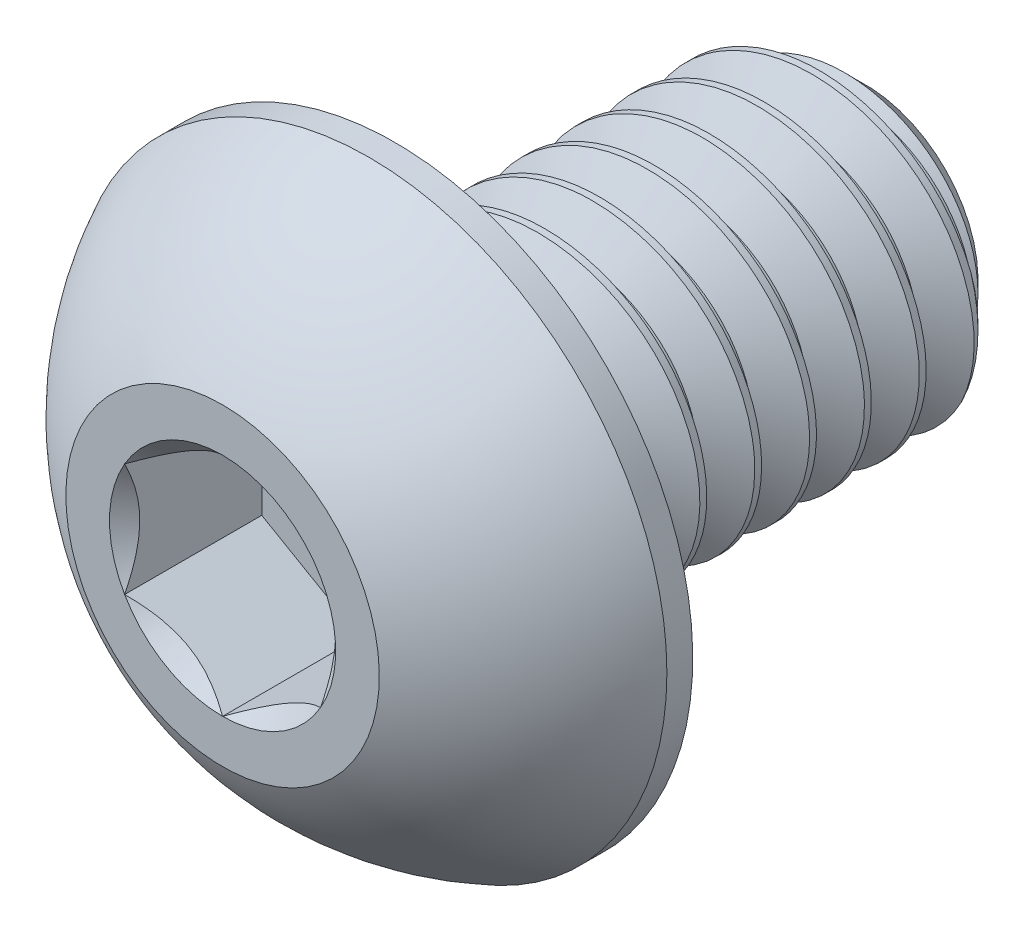
from build123d import *

# Parameters (mm, degrees)
CUT_EXTRUDE1_DEPTH = 1.75
CUT_SWEEP1_PITCH   = 0.7


# Read off the part's stored shape, not the designer's step: Split1
with BuildPart() as part:
    # Sketch2 → Revolve1 (revolve)
    with BuildSketch(Plane(origin=(0, 0, 0), x_dir=(0, 0, -1), z_dir=(1, 0, 0)), mode=Mode.PRIVATE) as revolve1_sk:
        with BuildLine():
            Line((-4.1, 0), (4.1, 0))
            Line((4.1, 0), (4.1, 1.44))
            Line((4.1, 1.44), (3.54, 2))
            Line((3.54, 2), (-1.9, 2))
            Line((-1.9, 2), (-1.9, 3.8))
            Line((-1.9, 3.8), (-2.23, 3.8))
            ThreePointArc((-2.23, 3.8), (-3.306499853, 3.047002626), (-4.1, 2))
            Line((-4.1, 2), (-4.1, 0))
        make_face()
    revolve(revolve1_sk.sketch.rotate(Axis((0, 0, 4.1), (0, 0, -1)), 180), axis=Axis((0, 0, 4.1), (0, 0, -1)))

    # Sketch3 → Cut-Extrude1 (cut)
    with BuildSketch(Plane.XY.offset(4.1)):
        Polygon((0, 1.443375673), (-1.25, 0.721687836), (-1.25, -0.721687836), (0, -1.443375673), (1.25, -0.721687836), (1.25, 0.721687836), align=None)
    extrude(amount=-CUT_EXTRUDE1_DEPTH, mode=Mode.SUBTRACT)

    # Cut-Extrude2 cone 1 section (through the dimple's axis) → Cut-Extrude2 (revolve, cut)
    with BuildSketch(Plane(origin=(0, 0, 4.1), x_dir=(0, -1, 0), z_dir=(1, 0, 0))):
        Polygon((0, 0), (1.443375673, 0), (0, 1.443375673), align=None)
    revolve(axis=Axis((0, 0, 4.1), (0, 0, -1)), mode=Mode.SUBTRACT)


with BuildPart() as body_2:
    # Split1: the piece on the far side of the plane
    add(part.part)
    split(bisect_by=Plane.XY.offset(1.9), keep=Keep.BOTTOM)

    # Cut-Sweep1: the profile of Sketch6 screwed along a right-hand helix of 9.571429 turns, 6 arcs to a turn; built about Z, then put on its axis
    cut_sweep1_z = Axis((0, 0, 0), (0, 0, 1))
    cut_sweep1_corners = [(1.545336663, 0, -0.2625), (1.545336663, 0, -0.35), (2.037888611, 0, -0.634375), (2.037888611, 0, 0.021875)]
    with BuildLine(mode=Mode.PRIVATE) as cut_sweep1_profile:
        Line(cut_sweep1_corners[0], cut_sweep1_corners[1])
        Line(cut_sweep1_corners[1], cut_sweep1_corners[2])
        Line(cut_sweep1_corners[2], cut_sweep1_corners[3])
        Line(cut_sweep1_corners[3], cut_sweep1_corners[0])
    cut_sweep1_cap = Face(cut_sweep1_profile.wire())
    cut_sweep1_turn_angles = [0, 30, 60, 90, 120, 150, 180, 210, 240, 270, 300, 330, 360]
    cut_sweep1_turn_weights = [1, 0.8660254037844387, 1, 0.8660254037844387, 1, 0.8660254037844387, 1, 0.8660254037844387, 1, 0.8660254037844387, 1, 0.8660254037844387, 1]
    cut_sweep1_turn_rails = [Edge.make_bspline([Vector(p[0], p[1], 0).rotate(cut_sweep1_z, cut_sweep1_turn_angles[k]) / cut_sweep1_turn_weights[k] + Vector(0, 0, p[2] + CUT_SWEEP1_PITCH * cut_sweep1_turn_angles[k] / 360) for k in range(13)], [0, 0, 0, 1, 1, 2, 2, 3, 3, 4, 4, 5, 5, 6, 6, 6], 2, cut_sweep1_turn_weights) for p in cut_sweep1_corners]
    cut_sweep1_turn_sides = [Face.make_surface_from_curves(cut_sweep1_turn_rails[p[0]], cut_sweep1_turn_rails[p[1]]) for p in [(0, 1), (1, 2), (2, 3), (3, 0)]]
    cut_sweep1_last_angles = [3240, 3270, 3300, 3330, 3360, 3390, 3420, 3432.857142857, 3445.714285714]
    cut_sweep1_last_weights = [1, 0.8660254037844387, 1, 0.8660254037844387, 1, 0.8660254037844387, 1, 0.974927912181849, 1]
    cut_sweep1_last_rails = [Edge.make_bspline([Vector(p[0], p[1], 0).rotate(cut_sweep1_z, cut_sweep1_last_angles[k]) / cut_sweep1_last_weights[k] + Vector(0, 0, p[2] + CUT_SWEEP1_PITCH * cut_sweep1_last_angles[k] / 360) for k in range(9)], [0, 0, 0, 1, 1, 2, 2, 3, 3, 4, 4, 4], 2, cut_sweep1_last_weights) for p in cut_sweep1_corners]
    cut_sweep1_last_sides = [Face.make_surface_from_curves(cut_sweep1_last_rails[p[0]], cut_sweep1_last_rails[p[1]]) for p in [(0, 1), (1, 2), (2, 3), (3, 0)]]
    cut_sweep1 = Plane(origin=(0, 0, -4.1), x_dir=(0, 1, 0), z_dir=(0, 0, 1)) * Solid(Shell([*[p.moved(Location((0, 0, CUT_SWEEP1_PITCH * i))) for i in range(9) for p in cut_sweep1_turn_sides], *cut_sweep1_last_sides, cut_sweep1_cap, cut_sweep1_cap.rotate(cut_sweep1_z, 3445.714285714).moved(Location((0, 0, CUT_SWEEP1_PITCH * 3445.714285714 / 360)))]))
    add(cut_sweep1, mode=Mode.SUBTRACT)


with BuildPart() as part_1:
    add(part.part)

    # Split1
    split(bisect_by=Plane.XY.offset(1.9), keep=Keep.TOP)

    add(body_2.part)  # Boss-Extrude1 merges body 2
    # Boss-Extrude1 cone 1 section (through the dimple's axis) → Boss-Extrude1 (revolve)
    with BuildSketch(Plane(origin=(0, 0, 1.9), x_dir=(0, -1, 0), z_dir=(1, 0, 0))):
        Polygon((0, 0), (2, 0), (0, 3.464101615), align=None)
    revolve(axis=Axis((0, 0, 1.9), (0, 0, -1)))


solid = part_1.part
